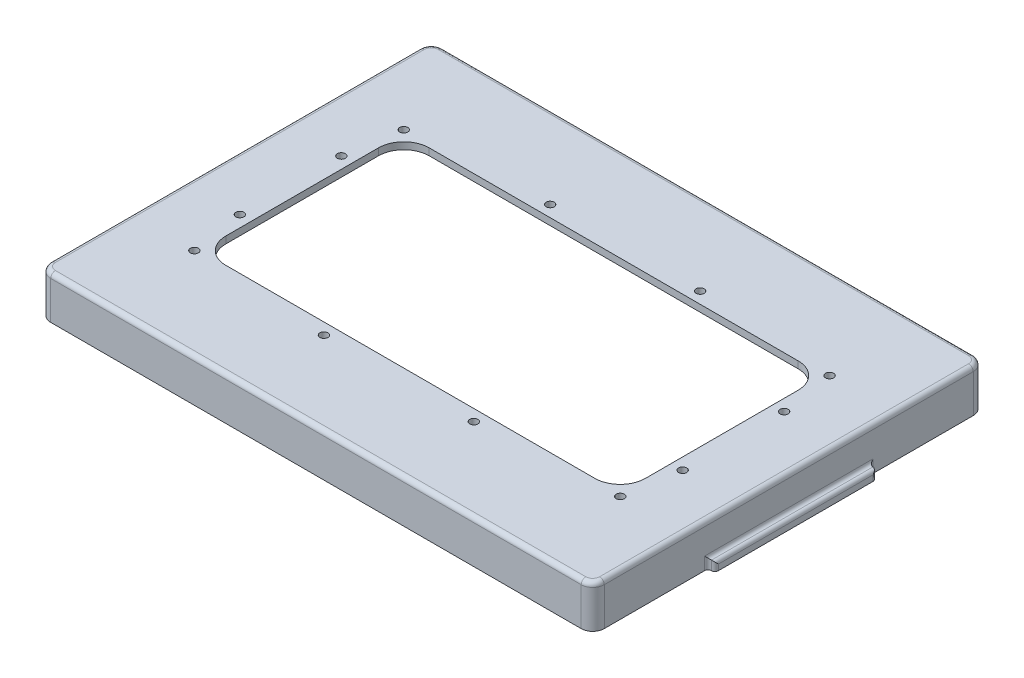
from build123d import *

# Parameters (mm, degrees)
EXTRUDE_1_DEPTH     = 15.5
EXTRUDE_2_DEPTH     = 3
FILLET_2_R          = 2
SKETCH_4_W          = 3
SKETCH_4_H          = 70
EXTRUDE_3_DEPTH     = 4
FILLET_3_R          = 1.5
CUT_EXTRUDE_3_DEPTH = 151.652746407
SKETCH_10_R         = 1.75
CUT_EXTRUDE_4_DEPTH = 164.099662783
SKETCH_9_R          = 1.75
CUT_EXTRUDE_5_DEPTH = 164.099662783


with BuildPart() as part:
    # 草图1 → 凸台-拉伸1 (new body)
    with BuildSketch(Plane(origin=(0, 0, 0), x_dir=(1, 0, 0), z_dir=(0, 1, 0))):
        with BuildLine():
            Line((-115, 85), (115, 85))
            ThreePointArc((115, 85), (118.535533906, 83.535533906), (120, 80))
            Line((120, 80), (120, -80))
            ThreePointArc((120, -80), (118.535533906, -83.535533906), (115, -85))
            Line((115, -85), (-115, -85))
            ThreePointArc((-115, -85), (-118.535533906, -83.535533906), (-120, -80))
            Line((-120, -80), (-120, 80))
            ThreePointArc((-120, 80), (-118.535533906, 83.535533906), (-115, 85))
        make_face()
        with BuildLine():
            Line((-112.5, 82.5), (112.5, 82.5))
            ThreePointArc((112.5, 82.5), (116.035533906, 81.035533906), (117.5, 77.5))
            Line((117.5, 77.5), (117.5, -77.5))
            ThreePointArc((117.5, -77.5), (116.035533906, -81.035533906), (112.5, -82.5))
            Line((112.5, -82.5), (-112.5, -82.5))
            ThreePointArc((-112.5, -82.5), (-116.035533906, -81.035533906), (-117.5, -77.5))
            Line((-117.5, -77.5), (-117.5, 77.5))
            ThreePointArc((-117.5, 77.5), (-116.035533906, 81.035533906), (-112.5, 82.5))
        make_face(mode=Mode.SUBTRACT)
    extrude(amount=EXTRUDE_1_DEPTH)

    # 草图3 → 凸台-拉伸2 (add)
    with BuildSketch(Plane(origin=(0, 15.5, 0), x_dir=(1, 0, 0), z_dir=(0, 1, 0))):
        with BuildLine():
            Line((-120, 80), (-120, -80))
            ThreePointArc((-120, -80), (-118.535533906, -83.535533906), (-115, -85))
            Line((-115, -85), (115, -85))
            ThreePointArc((115, -85), (118.535533906, -83.535533906), (120, -80))
            Line((120, -80), (120, 80))
            ThreePointArc((120, 80), (118.535533906, 83.535533906), (115, 85))
            Line((115, 85), (-115, 85))
            ThreePointArc((-115, 85), (-118.535533906, 83.535533906), (-120, 80))
        make_face()
    extrude(amount=EXTRUDE_2_DEPTH)

    # 圆角2
    fillet_2_edges = [part.edges().sort_by_distance(p)[0] for p in [
        (116.035533906, 15.5, -81.035533906),
        (0, 15.5, -82.5),
        (-116.035533906, 15.5, -81.035533906),
        (-117.5, 15.5, 0),
        (-116.035533906, 15.5, 81.035533906),
        (0, 15.5, 82.5),
        (116.035533906, 15.5, 81.035533906),
        (117.5, 15.5, 0),
        (-118.535533906, 18.5, -83.535533906),
        (-120, 18.5, 0),
        (-118.535533906, 18.5, 83.535533906),
        (0, 18.5, 85),
        (118.535533906, 18.5, 83.535533906),
        (120, 18.5, 0),
        (118.535533906, 18.5, -83.535533906),
        (0, 18.5, -85),
    ]]
    fillet(fillet_2_edges, radius=FILLET_2_R)

    # 草图4 → 凸台-拉伸3 (add)
    with BuildSketch(Plane.XZ):
        with Locations((-121.5, 0)):
            Rectangle(SKETCH_4_W, SKETCH_4_H)
        with Locations((121.5, 0)):
            Rectangle(SKETCH_4_W, SKETCH_4_H)
    extrude(amount=-EXTRUDE_3_DEPTH)

    # 圆角3
    fillet_3_edges = [part.edges().sort_by_distance(p)[0] for p in [
        (120, 4, 0),
        (-120, 4, 0),
        (-123, 4, 0),
        (123, 4, 0),
        (120, 2, -35),
        (123, 2, -35),
        (123, 2, 35),
        (120, 2, 35),
        (-120, 2, -35),
        (-123, 2, -35),
        (-123, 2, 35),
        (-120, 2, 35),
    ]]
    fillet(fillet_3_edges, radius=FILLET_3_R - 0.0001)  # a hair under: the kernel refuses the full size

    # 草图5 → 切除-拉伸3 (cut, through all)
    with BuildSketch(Plane(origin=(0, 18.5, 0), x_dir=(1, 0, 0), z_dir=(0, 1, 0))):
        with BuildLine():
            Line((80, 44.1), (-80, 44.1))
            ThreePointArc((-80, 44.1), (-87.778174593, 40.878174593), (-91, 33.1))
            Line((-91, 33.1), (-91, -33.1))
            ThreePointArc((-91, -33.1), (-87.778174593, -40.878174593), (-80, -44.1))
            Line((-80, -44.1), (80, -44.1))
            ThreePointArc((80, -44.1), (87.778174593, -40.878174593), (91, -33.1))
            Line((91, -33.1), (91, 33.1))
            ThreePointArc((91, 33.1), (87.778174593, 40.878174593), (80, 44.1))
        make_face()
    extrude(amount=-CUT_EXTRUDE_3_DEPTH, mode=Mode.SUBTRACT)

    # 草图10 → 切除-拉伸4 (cut, through all)
    with BuildSketch(Plane(origin=(0, 18.5, -20.5), x_dir=(1, 0, 0), z_dir=(0, -1, 0))):
        with Locations(Location((-92.325207, 65.878427, 0), (0, 0, 90))):
            Circle(SKETCH_10_R)
        with Locations(Location((92.325207, 65.878427, 0), (0, 0, 90))):
            Circle(SKETCH_10_R)
        with Locations(Location((92.325207, -24.878427, 0), (0, 0, 90))):
            Circle(SKETCH_10_R)
        with Locations(Location((-92.325207, -24.878427, 0), (0, 0, 90))):
            Circle(SKETCH_10_R)
    extrude(amount=CUT_EXTRUDE_4_DEPTH, mode=Mode.SUBTRACT)

    # 草图9 → 切除-拉伸5 (cut, through all)
    with BuildSketch(Plane(origin=(0, 18.5, -20.5), x_dir=(1, 0, 0), z_dir=(0, -1, 0))):
        with Locations(Location((-32.5, 69.55, 0), (0, 0, 90))):
            Circle(SKETCH_9_R)
        with Locations(Location((-95.99678, 42.5, 0), (0, 0, 90))):
            Circle(SKETCH_9_R)
        with Locations(Location((-32.5, -28.55, 0), (0, 0, 90))):
            Circle(SKETCH_9_R)
        with Locations(Location((-95.99678, -1.5, 0), (0, 0, 90))):
            Circle(SKETCH_9_R)
        with Locations(Location((32.5, -28.55, 0), (0, 0, 90))):
            Circle(SKETCH_9_R)
        with Locations(Location((95.99678, -1.5, 0), (0, 0, 90))):
            Circle(SKETCH_9_R)
        with Locations(Location((32.5, 69.55, 0), (0, 0, 90))):
            Circle(SKETCH_9_R)
        with Locations(Location((95.99678, 42.5, 0), (0, 0, 90))):
            Circle(SKETCH_9_R)
    extrude(amount=CUT_EXTRUDE_5_DEPTH, mode=Mode.SUBTRACT)


solid = part.part
